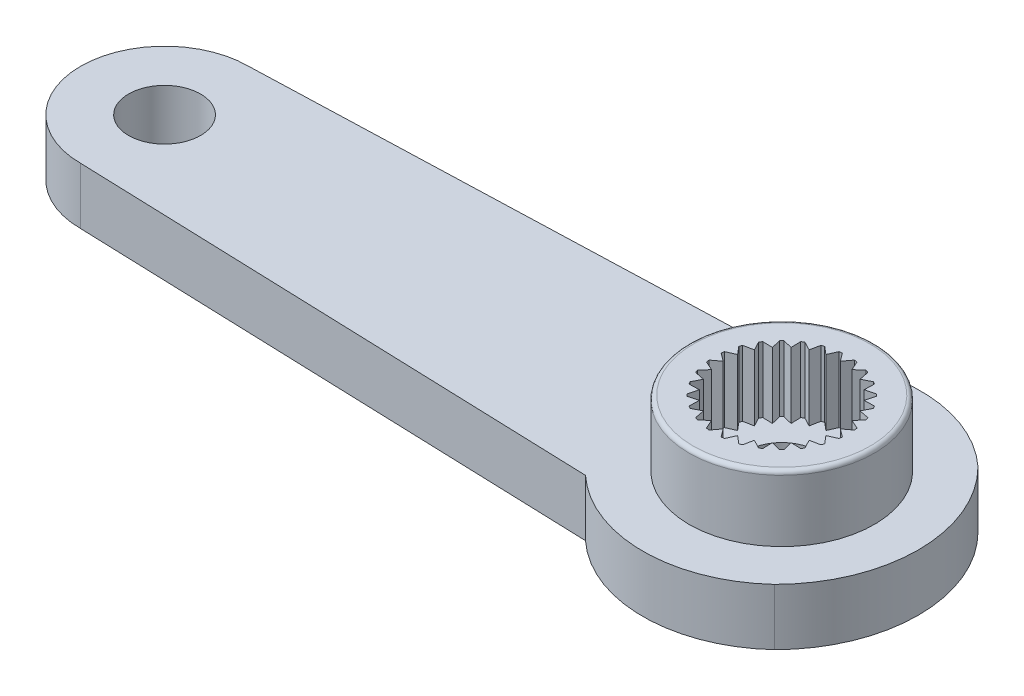
from build123d import *

# Parameters (mm, degrees)
SKETCH1_R           = 1.7
SKETCH1_R_2         = 1.75
BOSS_EXTRUDE1_DEPTH = 2.75
SKETCH2_R           = 4.5
SKETCH2_R_2         = 3.25
BOSS_EXTRUDE2_DEPTH = 3.2
BOSS_EXTRUDE3_DEPTH = 3.2
CIRPATTERN1_COUNT   = 28
SKETCH4_R           = 4.5
SKETCH4_R_2         = 3.5
SKETCH4_R_3         = 3
SKETCH4_R_4         = 1.7
CUT_EXTRUDE1_DEPTH  = 1
FILLET1_R           = 0.25
FILLET2_R           = 0.2


with BuildPart() as part:
    # Sketch1 → Boss-Extrude1 (new body)
    with BuildSketch(Plane(origin=(0, 0, 0), x_dir=(1, 0, 0), z_dir=(0, 1, 0))):
        with BuildLine():
            Line((-30, 4.082414086), (-4.589117562, 4.95))
            ThreePointArc((-4.589117562, 4.95), (0, 6.75), (4.589117562, 4.95))
            ThreePointArc((4.589117562, 4.95), (6.639474696, 0), (4.589117562, -4.95))
            ThreePointArc((4.589117562, -4.95), (0, -6.75), (-4.589117562, -4.95))
            Line((-4.589117562, -4.95), (-30, -4.082414086))
            ThreePointArc((-30, -4.082414086), (-34.082414086, 0), (-30, 4.082414086))
        make_face()
        with Locations(Location((0, 0, 0), (0, 0, 270))):
            Circle(SKETCH1_R, mode=Mode.SUBTRACT)
        with Locations(Location((-30, 0, 0), (0, 0, 270))):
            Circle(SKETCH1_R_2, mode=Mode.SUBTRACT)
    extrude(amount=BOSS_EXTRUDE1_DEPTH)

    # Sketch2 → Boss-Extrude2 (add)
    with BuildSketch(Plane(origin=(0, 2.75, 0), x_dir=(1, 0, 0), z_dir=(0, 1, 0))):
        with Locations(Location((0, 0, 0), (0, 0, 270))):
            Circle(SKETCH2_R)
        with Locations(Location((0, 0, 0), (0, 0, 270))):
            Circle(SKETCH2_R_2, mode=Mode.SUBTRACT)
    extrude(amount=BOSS_EXTRUDE2_DEPTH)

    # Sketch3 → Boss-Extrude3 (add)
    with BuildSketch(Plane(origin=(0, 5.95, 0), x_dir=(1, 0, 0), z_dir=(0, 1, 0))):
        Polygon((-0.3, 3.25), (0.3, 3.25), (0, 2.85), align=None)
    boss_extrude3 = extrude(amount=-BOSS_EXTRUDE3_DEPTH)

    # CirPattern1: Boss-Extrude3 ×28 about axis
    cirpattern1_axis = Axis((0, 0, 0), (0, 1, 0))
    for i in range(1, CIRPATTERN1_COUNT):
        add(boss_extrude3.rotate(cirpattern1_axis, i * 360 / CIRPATTERN1_COUNT))

    # Sketch4 → Cut-Extrude1 (cut)
    # profile 1 of 2: a face of its own
    with BuildSketch(Plane.XZ):
        with Locations(Location((0, 0, 0), (0, 0, 90))):
            Circle(SKETCH4_R)
        with Locations(Location((0, 0, 0), (0, 0, 270))):
            Circle(SKETCH4_R_2, mode=Mode.SUBTRACT)
    # profile 2 of 2: a face of its own
    with BuildSketch(Plane.XZ):
        with Locations(Location((0, 0, 0), (0, 0, 270))):
            Circle(SKETCH4_R_3)
        with Locations(Location((0, 0, 0), (0, 0, 270))):
            Circle(SKETCH4_R_4, mode=Mode.SUBTRACT)
    extrude(amount=-CUT_EXTRUDE1_DEPTH, mode=Mode.SUBTRACT)

    # Fillet1
    fillet1_edges = [part.edges().sort_by_distance(p)[0] for p in [
        (0, 0, 3.5),
        (0, 0, -4.5),
        (0, 0, 3),
    ]]
    fillet(fillet1_edges, radius=FILLET1_R - 0.0001)  # a hair under: the kernel refuses the full size

    # Fillet2
    fillet2_edges = [part.edges().sort_by_distance(p)[0] for p in [
        (0, 5.95, -4.5),
    ]]
    fillet(fillet2_edges, radius=FILLET2_R)


solid = part.part
